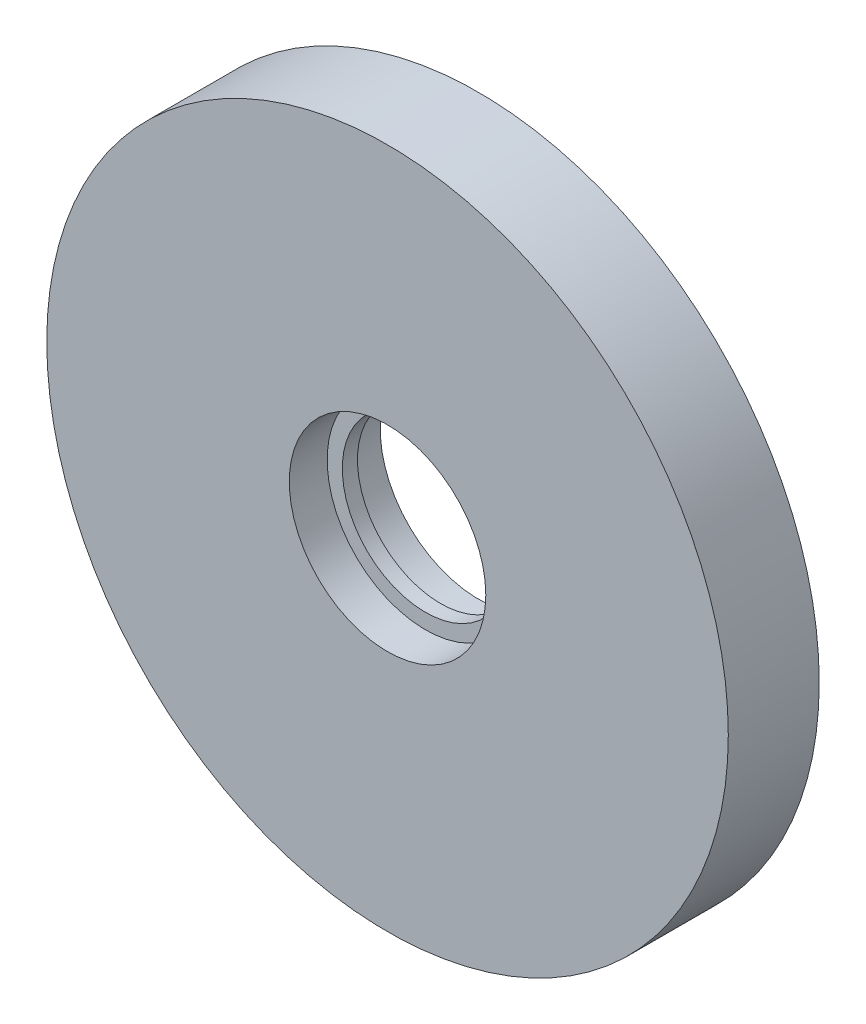
from build123d import *

# Parameters (mm, degrees)
BOSS_EXTRUDE1_DEPTH      = 4.5
BOSS_EXTRUDE1_DEPTH_BACK = 4.5
SKETCH1_R                = 33.725
CAVITY1_START            = 20.155580463
CAVITY1_OUTLINE_R        = 8.225
CAVITY1_DEPTH            = 4.5
CAVITY1_2_OUTLINE_R      = 9.725
CAVITY1_2_OUTLINE_R_2    = 8.225
CAVITY1_2_DEPTH          = 1.5
CAVITY1_START_2          = 23.155580463
CAVITY1_3_OUTLINE_R      = 9.725
CAVITY1_3_OUTLINE_R_2    = 8.225
CAVITY1_3_DEPTH          = 1.5
CAVITY1_START_3          = 17.905580463
CAVITY1_4_OUTLINE_R      = 3.725
CAVITY1_4_DEPTH          = 2.25
CAVITY1_5_DEPTH          = 2.25
CUT_EXTRUDE1_START       = 2.25
SKETCH1_3_R              = 9.725
CUT_EXTRUDE1_DEPTH       = 2.25
CUT_EXTRUDE2_DEPTH       = 2.25


with BuildPart() as part:
    # Sketch1 → Boss-Extrude1 (new, two sides: drawn at the far end of the back side and taken through both)
    with BuildSketch(Plane.XY.offset(22.405580463).offset(-BOSS_EXTRUDE1_DEPTH_BACK)):
        with Locations((-2.139643456, 12.812935379)):
            Circle(SKETCH1_R)
    extrude(amount=BOSS_EXTRUDE1_DEPTH + BOSS_EXTRUDE1_DEPTH_BACK)

    # Cavity1: read off the stored shape, not the designer's step
    # Cavity1 outline → Cavity1 (cut)
    with BuildSketch(Plane.XY.offset(CAVITY1_START)):
        with Locations((-2.139643456, 12.812935379)):
            Circle(CAVITY1_OUTLINE_R)
    extrude(amount=CAVITY1_DEPTH, mode=Mode.SUBTRACT)

    # Cavity1 2 outline → Cavity1 2 (cut)
    with BuildSketch(Plane.XY.offset(CAVITY1_START)):
        with Locations((-2.139643456, 12.812935379)):
            Circle(CAVITY1_2_OUTLINE_R)
        with Locations((-2.139643456, 12.812935379)):
            Circle(CAVITY1_2_OUTLINE_R_2, mode=Mode.SUBTRACT)
    extrude(amount=CAVITY1_2_DEPTH, mode=Mode.SUBTRACT)

    # Cavity1 3 outline → Cavity1 3 (cut)
    with BuildSketch(Plane.XY.offset(CAVITY1_START_2)):
        with Locations((-2.139643456, 12.812935379)):
            Circle(CAVITY1_3_OUTLINE_R)
        with Locations((-2.139643456, 12.812935379)):
            Circle(CAVITY1_3_OUTLINE_R_2, mode=Mode.SUBTRACT)
    extrude(amount=CAVITY1_3_DEPTH, mode=Mode.SUBTRACT)

    # Cavity1 4 outline → Cavity1 4 (cut)
    with BuildSketch(Plane.XY.offset(CAVITY1_START_3)):
        with Locations((-2.139643456, 12.812935379)):
            Circle(CAVITY1_4_OUTLINE_R)
    extrude(amount=CAVITY1_4_DEPTH, mode=Mode.SUBTRACT)

    # Sketch1<3> → Cut-Extrude1 (cut)
    with BuildSketch(Plane.XY.offset(22.405580463).offset(CUT_EXTRUDE1_START)):
        with Locations((-2.139643456, 12.812935379)):
            Circle(SKETCH1_3_R)
    cut_extrude1 = extrude(amount=CUT_EXTRUDE1_DEPTH, mode=Mode.SUBTRACT)

    # Mirror1: Cut-Extrude1 across plane
    add(cut_extrude1.mirror(Plane.XY.offset(22.405580463)), mode=Mode.SUBTRACT)


with BuildPart() as body_2:
    # Cavity1 5 outline → Cavity1 5 (new body)
    with BuildSketch(Plane.XY.offset(CAVITY1_START_3)):
        with BuildLine():
            ThreePointArc((-4.026439682, 14.637935379), (-4.764643456, 12.812935379), (-4.026439682, 10.987935379))
            Line((-4.026439682, 10.987935379), (-0.252847229, 10.987935379))
            ThreePointArc((-0.252847229, 10.987935379), (0.485356544, 12.812935379), (-0.252847229, 14.637935379))
            Line((-0.252847229, 14.637935379), (-4.026439682, 14.637935379))
        make_face()
    extrude(amount=CAVITY1_5_DEPTH)

    # Sketch2 → Cut-Extrude2 (cut)
    with BuildSketch(Plane.XY.offset(20.155580463)):
        with BuildLine():
            Line((-0.252847229, 14.637935379), (-4.026439682, 14.637935379))
            ThreePointArc((-4.026439682, 14.637935379), (-4.764643456, 12.812935379), (-4.026439682, 10.987935379))
            Line((-4.026439682, 10.987935379), (-0.252847229, 10.987935379))
            ThreePointArc((-0.252847229, 10.987935379), (0.485356544, 12.812935379), (-0.252847229, 14.637935379))
        make_face()
    extrude(amount=-CUT_EXTRUDE2_DEPTH, mode=Mode.SUBTRACT)


solid = part.part
